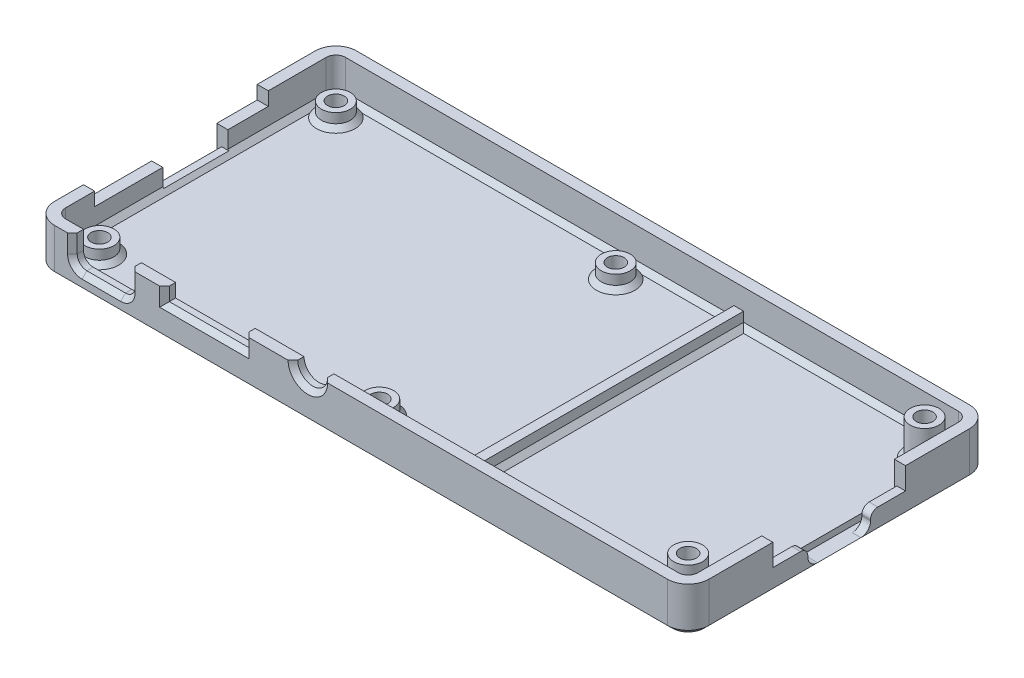
from build123d import *
from build123d.topology import SkipClean

# Parameters (mm, degrees)
SKETCH3_W                                         = 135.6
SKETCH3_H                                         = 62.6
SKETCH3_W_2                                       = 131
SKETCH3_H_2                                       = 58
BOSS_EXTRUDE1_DEPTH                               = 9.3
SKETCH5_W                                         = 131
SKETCH5_H                                         = 58
BOSS_EXTRUDE2_DEPTH                               = 2
SKETCH6_R                                         = 3
BOSS_EXTRUDE3_DEPTH                               = 3
SKETCH10_W                                        = 2
SKETCH10_H                                        = 58
BOSS_EXTRUDE4_DEPTH                               = 3
CUT_EXTRUDE1_REACH                                = 100.028
SKETCH11_R                                        = 3.1
SKETCH11_W                                        = 12
SKETCH11_H                                        = 5.8
SKETCH11_W_2                                      = 16.5
SKETCH11_H_2                                      = 2.8
CUT_EXTRUDE2_REACH                                = 142.206
SKETCH12_W                                        = 42
SKETCH12_H                                        = 2.8
SKETCH12_W_2                                      = 13.5
SKETCH12_H_2                                      = 3.7
FILLET6_R                                         = 2
FILLET8_R                                         = 2
CHAMFER1_SIZE                                     = 1
BOSS_EXTRUDE7_DEPTH                               = 7.3
FILLET20_R                                        = 4.3
CHAMFER5_SIZE                                     = 1
CSK_FOR_4_FLAT_HEAD_SOCKET_CAP_SCREW1_D           = 3.4544
CSK_FOR_4_FLAT_HEAD_SOCKET_CAP_SCREW1_DEPTH       = 14
CSK_FOR_4_FLAT_HEAD_SOCKET_CAP_SCREW1_CSINK_D     = 6.723761
CSK_FOR_4_FLAT_HEAD_SOCKET_CAP_SCREW1_CSINK_ANGLE = 82
CSK_FOR_4_FLAT_HEAD_SOCKET_CAP_SCREW1_TIP         = 1.037806461
CHAMFER7_SIZE                                     = 1
CHAMFER8_SIZE                                     = 1
CUT_EXTRUDE3_START                                = -7.3
CUT_EXTRUDE3_DEPTH                                = 7.3
FILLET21_R                                        = 2
CHAMFER9_SIZE                                     = 1
CUT_EXTRUDE4_DEPTH                                = 0.7
CUT_EXTRUDE4_DEPTH_BACK                           = 0.5
SKETCH30_W                                        = 27.5
SKETCH30_H                                        = 27.5
CUT_EXTRUDE5_DEPTH                                = 139.465527882
SKETCH32_W                                        = 2.3
SKETCH32_H                                        = 6
BOSS_EXTRUDE8_DEPTH                               = 2.8
CHAMFER10_SIZE                                    = 1
CHAMFER11_SIZE                                    = 1


# Some blends are built 0.0001 mm under size
with BuildPart() as part:
    # Sketch3 → Boss-Extrude1 (new body)
    with BuildSketch(Plane(origin=(0, 0, 0), x_dir=(1, 0, 0), z_dir=(0, 1, 0))):
        with Locations((-7.061766162, 3.105993834)):
            Rectangle(SKETCH3_W, SKETCH3_H)
        with Locations((-7.061766162, 3.105993834)):
            Rectangle(SKETCH3_W_2, SKETCH3_H_2, mode=Mode.SUBTRACT)
    extrude(amount=BOSS_EXTRUDE1_DEPTH)

    # Sketch5 → Boss-Extrude2 (add)
    with BuildSketch(Plane(origin=(0, 0, 0), x_dir=(1, 0, 0), z_dir=(0, 1, 0))):
        with Locations((-7.061766162, 3.105993834)):
            Rectangle(SKETCH5_W, SKETCH5_H)
    extrude(amount=BOSS_EXTRUDE2_DEPTH)

    # Sketch6 → Boss-Extrude3 (add)
    with BuildSketch(Plane(origin=(0, 2, 0), x_dir=(1, 0, 0), z_dir=(0, 1, 0))):
        with Locations(Location((-68.061766162, 27.605993834, 0), (0, 0, 270))):
            Circle(SKETCH6_R)
        with Locations(Location((-68.061766162, -21.394006166, 0), (0, 0, 270))):
            Circle(SKETCH6_R)
        with Locations(Location((-10.061766162, -21.394006166, 0), (0, 0, 270))):
            Circle(SKETCH6_R)
        with Locations(Location((-10.061766162, 27.605993834, 0), (0, 0, 270))):
            Circle(SKETCH6_R)
    extrude(amount=BOSS_EXTRUDE3_DEPTH)

    # Sketch10 → Boss-Extrude4 (add)
    with BuildSketch(Plane(origin=(0, 2, 0), x_dir=(1, 0, 0), z_dir=(0, 1, 0))):
        with Locations((10.938233838, 3.105993834)):
            Rectangle(SKETCH10_W, SKETCH10_H)
    extrude(amount=BOSS_EXTRUDE4_DEPTH)

    # Sketch11 → Cut-Extrude1 (cut, up to next)
    with BuildSketch(Plane.XY.offset(28.194006166), mode=Mode.PRIVATE) as cut_extrude1_sk1:
        with Locations((-18.061766162, 9.3)):
            Circle(SKETCH11_R)
    cut_extrude1_tool1 = extrude(cut_extrude1_sk1.sketch, amount=-CUT_EXTRUDE1_REACH, mode=Mode.PRIVATE) & part.part
    # Sketch11 → Cut-Extrude1 (cut, up to next)
    with BuildSketch(Plane.XY.offset(28.194006166), mode=Mode.PRIVATE) as cut_extrude1_sk2:
        with Locations((-60.861766162, 6.4)):
            Rectangle(SKETCH11_W, SKETCH11_H)
    cut_extrude1_tool2 = extrude(cut_extrude1_sk2.sketch, amount=-CUT_EXTRUDE1_REACH, mode=Mode.PRIVATE) & part.part
    # Sketch11 → Cut-Extrude1 (cut, up to next)
    with BuildSketch(Plane.XY.offset(28.194006166), mode=Mode.PRIVATE) as cut_extrude1_sk3:
        with Locations((-39.527982648, 7.9)):
            Rectangle(SKETCH11_W_2, SKETCH11_H_2)
    cut_extrude1_tool3 = extrude(cut_extrude1_sk3.sketch, amount=-CUT_EXTRUDE1_REACH, mode=Mode.PRIVATE) & part.part
    add(cut_extrude1_tool1.solids().sort_by_distance((-18.061766, 9.3, 28.194006))[0], mode=Mode.SUBTRACT)
    add(cut_extrude1_tool2.solids().sort_by_distance((-60.861766, 6.4, 28.194006))[0], mode=Mode.SUBTRACT)
    add(cut_extrude1_tool3.solids().sort_by_distance((-39.527983, 7.9, 28.194006))[0], mode=Mode.SUBTRACT)

    # Sketch12 → Cut-Extrude2 (cut, up to next)
    with BuildSketch(Plane.ZY.offset(74.861766162), mode=Mode.PRIVATE) as cut_extrude2_sk1:
        with Locations((-3.105993834, 7.9)):
            Rectangle(SKETCH12_W, SKETCH12_H)
    cut_extrude2_tool1 = extrude(cut_extrude2_sk1.sketch, amount=-CUT_EXTRUDE2_REACH, mode=Mode.PRIVATE) & part.part
    # Sketch12 → Cut-Extrude2 (cut, up to next)
    with BuildSketch(Plane.ZY.offset(74.861766162), mode=Mode.PRIVATE) as cut_extrude2_sk2:
        with Locations((-2.982922372, 4.65)):
            Rectangle(SKETCH12_W_2, SKETCH12_H_2)
    cut_extrude2_tool2 = extrude(cut_extrude2_sk2.sketch, amount=-CUT_EXTRUDE2_REACH, mode=Mode.PRIVATE) & part.part
    add(cut_extrude2_tool1.solids().sort_by_distance((-74.861766, 7.9, -3.105994))[0], mode=Mode.SUBTRACT)
    add(cut_extrude2_tool2.solids().sort_by_distance((-74.861766, 4.65, -2.982922))[0], mode=Mode.SUBTRACT)

    # Fillet6
    fillet6_edges = [part.edges().sort_by_distance(p)[0] for p in [
        (58.438233838, 5.65, -32.105993834),
    ]]
    fillet(fillet6_edges, radius=FILLET6_R)

    # Fillet8
    fillet8_edges = [part.edges().sort_by_distance(p)[0] for p in [
        (-72.561766162, 5.65, -32.105993834),
        (-72.561766162, 5.65, 25.894006166),
    ]]
    fillet(fillet8_edges, radius=FILLET8_R)

    # Chamfer1
    chamfer1_edges = [part.edges().sort_by_distance(p)[0] for p in [
        (-68.061766162, 2, -30.605993834),
        (-68.061766162, 2, 18.394006166),
        (-10.061766162, 2, 18.394006166),
        (-10.061766162, 2, -30.605993834),
    ]]
    chamfer(chamfer1_edges, length=CHAMFER1_SIZE)

    # Sketch24 → Boss-Extrude7 (add)
    with BuildSketch(Plane(origin=(0, 2, 0), x_dir=(1, 0, 0), z_dir=(0, 1, 0))):
        with BuildLine():
            Line((53.938233838, -18.394006166), (58.438233838, -18.394006166))
            Line((58.438233838, -18.394006166), (58.438233838, -25.894006166))
            Line((58.438233838, -25.894006166), (50.938233838, -25.894006166))
            Line((50.938233838, -25.894006166), (50.938233838, -21.394006166))
            ThreePointArc((50.938233838, -21.394006166), (51.816913494, -19.272685822), (53.938233838, -18.394006166))
        make_face()
        with BuildLine():
            Line((50.938233838, 27.605993834), (50.938233838, 32.105993834))
            Line((50.938233838, 32.105993834), (58.438233838, 32.105993834))
            Line((58.438233838, 32.105993834), (58.438233838, 24.605993834))
            Line((58.438233838, 24.605993834), (53.938233838, 24.605993834))
            ThreePointArc((53.938233838, 24.605993834), (51.816913494, 25.484673491), (50.938233838, 27.605993834))
        make_face()
    extrude(amount=BOSS_EXTRUDE7_DEPTH)

    # Fillet20
    fillet20_edges = [part.edges().sort_by_distance(p)[0] for p in [
        (-74.861766162, 4.65, -34.405993834),
        (60.738233838, 4.65, -34.405993834),
        (60.738233838, 4.65, 28.194006166),
        (-74.861766162, 4.65, 28.194006166),
    ]]
    fillet(fillet20_edges, radius=FILLET20_R)

    # Chamfer5
    # the kernel refuses this chamfer: 1 mm, written as the material it adds along each edge
    with BuildSketch(Plane(origin=(-70.561766162, 2, 23.894006166), x_dir=(0, 0, 1), z_dir=(1, 0, 0))) as chamfer5_piece_1:
        Polygon((2, -CHAMFER5_SIZE), (2 - CHAMFER5_SIZE, 0), (2, 0), align=None)
    revolve(axis=Axis((-70.561766162, 2, 23.894006166), (0, -1, 0)), revolution_arc=90)
    with BuildSketch(Plane(origin=(-70.561766162, 2, -30.105993834), x_dir=(0, 0, -1), z_dir=(1, 0, 0))) as chamfer5_piece_2:
        Polygon((2 - CHAMFER5_SIZE, 0), (2, CHAMFER5_SIZE), (2, 0), align=None)
    revolve(axis=Axis((-70.561766162, 2, -30.105993834), (0, 1, 0)), revolution_arc=90)
    with BuildSketch(Plane(origin=(12.509916826, 2, 25.894006166), x_dir=(0, 0.9996219169112968, 0.027495876610585623), z_dir=(-1, 0, 0))) as chamfer5_piece_3:
        Polygon((CHAMFER5_SIZE * 0.999621916911, CHAMFER5_SIZE * 0.0274958766106), (-CHAMFER5_SIZE * 0.0274958766106, CHAMFER5_SIZE * 0.999621916911), (0, 0), align=None)
    extrude(amount=83.071682988)
    with BuildSketch(Plane(origin=(-70.561766162, 2, -32.105993834), x_dir=(0, -0.027495876610586296, 0.9996219169112968), z_dir=(1, 0, 0))) as chamfer5_piece_4:
        Polygon((CHAMFER5_SIZE * 0.999621916911, -CHAMFER5_SIZE * 0.0274958766106), (-CHAMFER5_SIZE * 0.0274958766106, -CHAMFER5_SIZE * 0.999621916911), (0, 0), align=None)
    extrude(amount=83.071682988)
    with BuildSketch(Plane(origin=(9.938233838, 2, 25.894006166), x_dir=(-0.9996219169112968, -0.027495876610586296, 0), z_dir=(0, 0, -1))) as chamfer5_piece_5:
        Polygon((CHAMFER5_SIZE * 0.999621916911, CHAMFER5_SIZE * 0.0274958766106), (-CHAMFER5_SIZE * 0.0274958766106, CHAMFER5_SIZE * 0.999621916911), (0, 0), align=None)
    extrude(amount=58)
    with BuildSketch(Plane(origin=(11.938233838, 2, -32.105993834), x_dir=(-0.027495876610585623, 0.9996219169112968, 0), z_dir=(0, 0, 1))) as chamfer5_piece_6:
        Polygon((CHAMFER5_SIZE * 0.999621916911, -CHAMFER5_SIZE * 0.0274958766106), (-CHAMFER5_SIZE * 0.0274958766106, -CHAMFER5_SIZE * 0.999621916911), (0, 0), align=None)
    extrude(amount=58)
    with BuildSketch(Plane(origin=(9.36655085, 2, -32.105993834), x_dir=(0, -0.027495876610586296, 0.9996219169112968), z_dir=(1, 0, 0))) as chamfer5_piece_7:
        Polygon((CHAMFER5_SIZE * 0.999621916911, -CHAMFER5_SIZE * 0.0274958766106), (-CHAMFER5_SIZE * 0.0274958766106, -CHAMFER5_SIZE * 0.999621916911), (0, 0), align=None)
    extrude(amount=44.143365976)
    with BuildSketch(Plane(origin=(53.509916826, 2, 25.894006166), x_dir=(0, 0.9996219169112968, 0.027495876610585623), z_dir=(-1, 0, 0))) as chamfer5_piece_8:
        Polygon((CHAMFER5_SIZE * 0.999621916911, CHAMFER5_SIZE * 0.0274958766106), (-CHAMFER5_SIZE * 0.0274958766106, CHAMFER5_SIZE * 0.999621916911), (0, 0), align=None)
    extrude(amount=44.143365976)
    with BuildSketch(Plane(origin=(58.438233838, 2, -27.177676822), x_dir=(-0.9996219169112968, -0.0274958766105862, 0), z_dir=(0, 0, 1))) as chamfer5_piece_9:
        Polygon((CHAMFER5_SIZE * 0.999621916911, -CHAMFER5_SIZE * 0.0274958766106), (-CHAMFER5_SIZE * 0.0274958766106, -CHAMFER5_SIZE * 0.999621916911), (0, 0), align=None)
    extrude(amount=48.143365976)
    with BuildSketch(Plane(origin=(-72.561766162, 2, 23.894006166), x_dir=(-0.027495876610568366, 0.9996219169112972, 0), z_dir=(0, 0, -1))) as chamfer5_piece_10_section:
        Polygon((CHAMFER5_SIZE * 0.999621916911, CHAMFER5_SIZE * 0.0274958766106), (-CHAMFER5_SIZE * 0.0274958766106, CHAMFER5_SIZE * 0.999621916911), (0, 0), align=None)
    chamfer5_piece_10 = extrude(amount=54, mode=Mode.PRIVATE)
    chamfer5_piece_10 = split(chamfer5_piece_10, bisect_by=Plane(origin=(-72.495550112, 2.866891976, 3.767077628), z_dir=(0, 0, 1)), keep=Keep.TOP, mode=Mode.PRIVATE)
    add(chamfer5_piece_10)
    with BuildSketch(Plane(origin=(-72.561766162, 2, 23.894006166), x_dir=(-0.027495876610568366, 0.9996219169112972, 0), z_dir=(0, 0, -1))) as chamfer5_piece_11_section:
        Polygon((CHAMFER5_SIZE * 0.999621916911, CHAMFER5_SIZE * 0.0274958766106), (-CHAMFER5_SIZE * 0.0274958766106, CHAMFER5_SIZE * 0.999621916911), (0, 0), align=None)
    chamfer5_piece_11 = extrude(amount=54, mode=Mode.PRIVATE)
    chamfer5_piece_11 = split(chamfer5_piece_11, bisect_by=Plane(origin=(-72.217321718, 2.8, -2.982922372), z_dir=(0, -1, 0)), keep=Keep.TOP, mode=Mode.PRIVATE)
    add(chamfer5_piece_11)
    with BuildSketch(Plane(origin=(-72.561766162, 2, 23.894006166), x_dir=(-0.027495876610568366, 0.9996219169112972, 0), z_dir=(0, 0, -1))) as chamfer5_piece_12_section:
        Polygon((CHAMFER5_SIZE * 0.999621916911, CHAMFER5_SIZE * 0.0274958766106), (-CHAMFER5_SIZE * 0.0274958766106, CHAMFER5_SIZE * 0.999621916911), (0, 0), align=None)
    chamfer5_piece_12 = extrude(amount=54, mode=Mode.PRIVATE)
    chamfer5_piece_12 = split(chamfer5_piece_12, bisect_by=Plane(origin=(-72.495544539, 2.866889189, -9.732922372), z_dir=(0, 0, -1)), keep=Keep.TOP, mode=Mode.PRIVATE)
    add(chamfer5_piece_12)

    # CSK for #4 Flat Head Socket Cap Screw1
    with Locations(Plane(origin=(0, 0, 0), x_dir=(-1, 0, 0), z_dir=(0, -1, 0))):
        with Locations((68.061766162, 27.605993834), (68.061766162, -21.394006166), (-53.938233838, 27.605993834), (-53.938233838, -21.394006166), (10.061766162, -21.394006166), (10.061766162, 27.605993834)):
            CounterSinkHole(CSK_FOR_4_FLAT_HEAD_SOCKET_CAP_SCREW1_D / 2, CSK_FOR_4_FLAT_HEAD_SOCKET_CAP_SCREW1_CSINK_D / 2, depth=CSK_FOR_4_FLAT_HEAD_SOCKET_CAP_SCREW1_DEPTH, counter_sink_angle=CSK_FOR_4_FLAT_HEAD_SOCKET_CAP_SCREW1_CSINK_ANGLE)
            with Locations((0, 0, -(CSK_FOR_4_FLAT_HEAD_SOCKET_CAP_SCREW1_DEPTH + CSK_FOR_4_FLAT_HEAD_SOCKET_CAP_SCREW1_TIP / 2))):  # 118° drill point
                Cone(0, CSK_FOR_4_FLAT_HEAD_SOCKET_CAP_SCREW1_D / 2, CSK_FOR_4_FLAT_HEAD_SOCKET_CAP_SCREW1_TIP, mode=Mode.SUBTRACT)

    # Chamfer7
    chamfer7_edges = [part.edges().sort_by_distance(p)[0] for p in [
        (-7.061766162, 0, -34.405993834),
        (-74.861766162, 0, -3.105993834),
        (60.738233838, 0, -3.105993834),
        (-7.061766162, 0, 28.194006166),
        (59.478792997, 0, 26.934565325),
        (-73.602325321, 0, 26.934565325),
        (-73.602325321, 0, -33.146552993),
        (59.478792997, 0, -33.146552993),
    ]]
    chamfer(chamfer7_edges, length=CHAMFER7_SIZE)

    # Chamfer8
    chamfer8_edges = [part.edges().sort_by_distance(p)[0] for p in [
        (-74.861766162, 2.8, -2.982922372),
    ]]
    chamfer(chamfer8_edges, length=CHAMFER8_SIZE)

    # Sketch29 → Cut-Extrude3 (cut)
    with SkipClean():  # the faces are left unmerged after this step: merging them gives an invalid solid
        with BuildSketch(Plane(origin=(0, 9.3, 0), x_dir=(1, 0, 0), z_dir=(0, 1, 0)).offset(CUT_EXTRUDE3_START)):
            with BuildLine():
                Line((53.938233838, 24.605993834), (58.438233838, 24.605993834))
                Line((58.438233838, 24.605993834), (58.438233838, 30.105993834))
                ThreePointArc((58.438233838, 30.105993834), (57.8524474, 31.520207397), (56.438233838, 32.105993834))
                Line((56.438233838, 32.105993834), (50.938233838, 32.105993834))
                Line((50.938233838, 32.105993834), (50.938233838, 27.605993834))
                ThreePointArc((50.938233838, 27.605993834), (56.059554181, 29.727314178), (53.938233838, 24.605993834))
            make_face()
            with BuildLine():
                Line((53.938233838, -18.394006166), (58.438233838, -18.394006166))
                Line((58.438233838, -18.394006166), (58.438233838, -23.894006166))
                ThreePointArc((58.438233838, -23.894006166), (57.8524474, -25.308219728), (56.438233838, -25.894006166))
                Line((56.438233838, -25.894006166), (50.938233838, -25.894006166))
                Line((50.938233838, -25.894006166), (50.938233838, -21.394006166))
                ThreePointArc((50.938233838, -21.394006166), (56.059554181, -23.515326509), (53.938233838, -18.394006166))
            make_face()
        extrude(amount=CUT_EXTRUDE3_DEPTH, mode=Mode.SUBTRACT)

    # Fillet21
    fillet21_edges = [part.edges().sort_by_distance(p)[0] for p in [
        (-66.861766162, 3.5, 27.044006166),
        (-54.861766162, 3.5, 27.044006166),
    ]]
    fillet(fillet21_edges, radius=FILLET21_R)

    # Chamfer9
    chamfer9_edges = [part.edges().sort_by_distance(p)[0] for p in [
        (-18.061766162, 6.2, 28.194006166),
        (-54.861766162, 7.4, 28.194006166),
        (-60.861766162, 3.5, 28.194006166),
        (-55.4475526, 4.085786438, 28.194006166),
        (-66.275979725, 4.085786438, 28.194006166),
        (-66.861766162, 7.4, 28.194006166),
        (-47.777982648, 7.9, 28.194006166),
        (-39.527982648, 6.5, 28.194006166),
        (-31.277982648, 7.9, 28.194006166),
    ]]
    chamfer(chamfer9_edges, length=CHAMFER9_SIZE)

    # Sketch30 → Cut-Extrude4 (cut, two sides: drawn at the far end of the back side and taken through both)
    with SkipClean():  # the faces are left unmerged after this step: merging them gives an invalid solid
        with BuildSketch(Plane.ZY.offset(-58.438233838).offset(-CUT_EXTRUDE4_DEPTH_BACK)):
            with Locations((-3.105993834, 14.75)):
                Rectangle(SKETCH30_W, SKETCH30_H)
        extrude(amount=CUT_EXTRUDE4_DEPTH + CUT_EXTRUDE4_DEPTH_BACK, mode=Mode.SUBTRACT)

    # Sketch31 → Cut-Extrude5 (cut, through all)
    with SkipClean():  # the faces are left unmerged after this step: merging them gives an invalid solid
        with BuildSketch(Plane.ZY.offset(-58.938233838)):
            with BuildLine():
                Line((-16.855993834, 4.75), (-11.105993834, 4.75))
                ThreePointArc((-11.105993834, 4.75), (-10.045333663, 4.310660172), (-9.605993834, 3.25))
                Line((-9.605993834, 3.25), (-9.605993834, 3))
                ThreePointArc((-9.605993834, 3), (-9.020207397, 1.585786438), (-7.605993834, 1))
                Line((-7.605993834, 1), (1.394006166, 1))
                ThreePointArc((1.394006166, 1), (2.808219728, 1.585786438), (3.394006166, 3))
                Line((3.394006166, 3), (3.394006166, 3.25))
                ThreePointArc((3.394006166, 3.25), (3.833345994, 4.310660172), (4.894006166, 4.75))
                Line((4.894006166, 4.75), (10.644006166, 4.75))
                Line((10.644006166, 4.75), (10.644006166, 9.3))
                Line((10.644006166, 9.3), (-16.855993834, 9.3))
                Line((-16.855993834, 9.3), (-16.855993834, 4.75))
            make_face()
        extrude(amount=-CUT_EXTRUDE5_DEPTH, mode=Mode.SUBTRACT)

    # Sketch32 → Boss-Extrude8 (add)
    with SkipClean():  # the faces are left unmerged after this step: merging them gives an invalid solid
        with BuildSketch(Plane(origin=(0, 6.5, 0), x_dir=(1, 0, 0), z_dir=(0, 1, 0))):
            with Locations((-73.711766162, 21.105993834)):
                Rectangle(SKETCH32_W, SKETCH32_H)
        extrude(amount=BOSS_EXTRUDE8_DEPTH)

    # Chamfer10
    chamfer10_edges = [part.edges().sort_by_distance(p)[0] for p in [
        (58.438233838, 2, 21.144006166),
        (57.8524474, 2, 25.308219728),
        (53.688233838, 2, 25.894006166),
        (57.8524474, 2, -31.520207397),
        (53.688233838, 2, -32.105993834),
    ]]
    chamfer(chamfer10_edges, length=CHAMFER10_SIZE - 0.0001)  # a hair under: the kernel refuses the full size

    # Chamfer11
    # the kernel refuses this chamfer: 1 mm, written as the material it adds along each edge
    with BuildSketch(Plane(origin=(53.938233838, 2, 21.394006166), x_dir=(-1, 0, 0), z_dir=(0, 0, -1))) as chamfer11_piece_1:
        Polygon((3 + CHAMFER11_SIZE, 0), (3, CHAMFER11_SIZE), (3, 0), align=None)
    revolve(axis=Axis((53.938233838, 2, 21.394006166), (0, 1, 0)), revolution_arc=270)
    with BuildSketch(Plane(origin=(53.938233838, 2, -27.605993834), x_dir=(0, 0, 1), z_dir=(1, 0, 0))) as chamfer11_piece_2:
        Polygon((3 + CHAMFER11_SIZE, 0), (3, -CHAMFER11_SIZE), (3, 0), align=None)
    revolve(axis=Axis((53.938233838, 2, -27.605993834), (0, -1, 0)), revolution_arc=90)
    with BuildSketch(Plane(origin=(53.938233838, 2, -27.605993834), x_dir=(-1, 0, 0), z_dir=(0, 0, 1))) as chamfer11_piece_3:
        Polygon((3 + CHAMFER11_SIZE, 0), (3, -CHAMFER11_SIZE), (3, 0), align=None)
    revolve(axis=Axis((53.938233838, 2, -27.605993834), (0, -1, 0)), revolution_arc=270)
    with BuildSketch(Plane(origin=(53.938233838, 2, 21.394006166), x_dir=(-1, 0, 0), z_dir=(0, 0, 1))) as chamfer11_piece_4:
        Polygon((3 + CHAMFER11_SIZE, 0), (3, -CHAMFER11_SIZE), (3, 0), align=None)
    revolve(axis=Axis((53.938233838, 2, 21.394006166), (0, -1, 0)), revolution_arc=90)


solid = part.part
